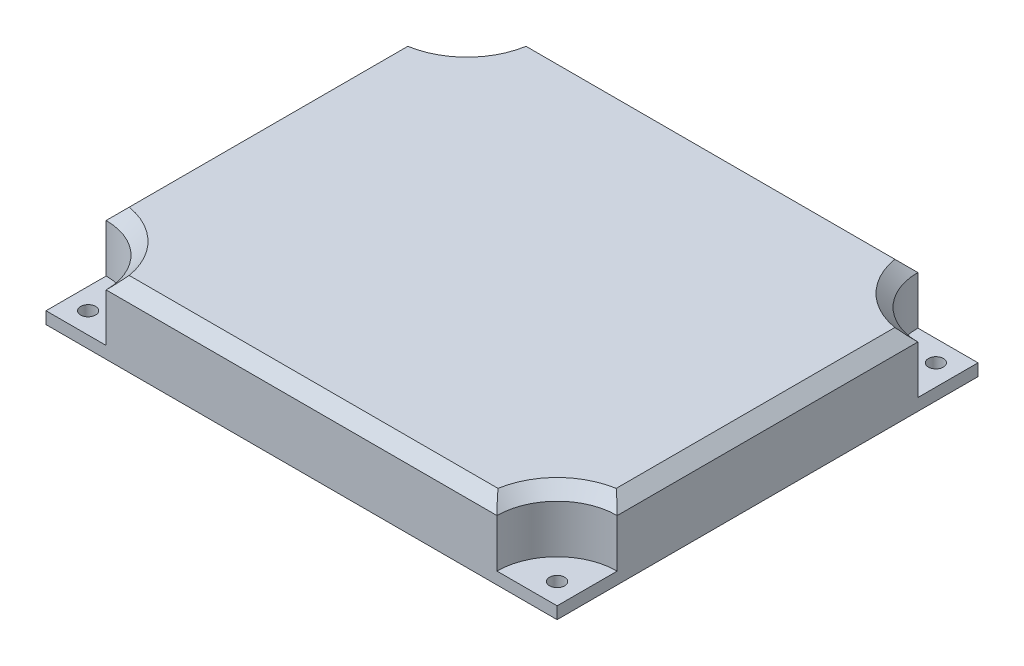
from build123d import *

# Parameters (mm, degrees)
SKETCH2_W                 = 85
SKETCH2_H                 = 70
BOSS_EXTRUDE1_DEPTH       = 12
SKETCH4_R                 = 10
CUT_EXTRUDE3_DEPTH        = 10
FILLET2_SIZE              = 2
M3X0_5_TAPPED_HOLE1_D     = 2.5
M3X0_5_TAPPED_HOLE1_DEPTH = 10
M3X0_5_TAPPED_HOLE1_TIP   = 0.751075774
CUT_EXTRUDE4_DEPTH        = 8


with BuildPart() as part:
    # Sketch2 → Boss-Extrude1 (new body)
    with BuildSketch(Plane(origin=(0, 0, 0), x_dir=(1, 0, 0), z_dir=(0, 1, 0))):
        Rectangle(SKETCH2_W, SKETCH2_H)
    extrude(amount=BOSS_EXTRUDE1_DEPTH)

    # Sketch4 → Cut-Extrude3 (cut)
    with BuildSketch(Plane(origin=(0, 12, 0), x_dir=(1, 0, 0), z_dir=(0, 1, 0))):
        with Locations((42.5, -35)):
            Circle(SKETCH4_R)
        with Locations((-42.5, -35)):
            Circle(SKETCH4_R)
        with Locations((-42.5, 35)):
            Circle(SKETCH4_R)
        with Locations((42.5, 35)):
            Circle(SKETCH4_R)
    extrude(amount=-CUT_EXTRUDE3_DEPTH, mode=Mode.SUBTRACT)

    # Fillet2
    fillet2_edges = [part.edges().sort_by_distance(p)[0] for p in [
        (42.5, 12, 0),
        (35.428932188, 12, 27.928932188),
        (0, 12, 35),
        (-35.428932188, 12, 27.928932188),
        (-42.5, 12, 0),
        (-35.428932188, 12, -27.928932188),
        (0, 12, -35),
        (35.428932188, 12, -27.928932188),
    ]]
    chamfer(fillet2_edges, length=FILLET2_SIZE)

    # M3x0.5 Tapped Hole1
    with Locations(Plane(origin=(0, 2, 0), x_dir=(1, 0, 0), z_dir=(0, 1, 0))):
        with Locations((-39, 31.5), (-39, -31.5), (39, -31.5), (39, 31.5)):
            Hole(M3X0_5_TAPPED_HOLE1_D / 2, depth=M3X0_5_TAPPED_HOLE1_DEPTH)
            with Locations((0, 0, -(M3X0_5_TAPPED_HOLE1_DEPTH + M3X0_5_TAPPED_HOLE1_TIP / 2))):  # 118° drill point
                Cone(0, M3X0_5_TAPPED_HOLE1_D / 2, M3X0_5_TAPPED_HOLE1_TIP, mode=Mode.SUBTRACT)

    # Sketch8 → Cut-Extrude4 (cut)
    with BuildSketch(Plane.XZ):
        with BuildLine():
            Line((35.95, -26.45), (35.95, 26.45))
            ThreePointArc((35.95, 26.45), (35.657106781, 27.157106781), (34.95, 27.45))
            Line((34.95, 27.45), (-34.95, 27.45))
            ThreePointArc((-34.95, 27.45), (-35.657106781, 27.157106781), (-35.95, 26.45))
            Line((-35.95, 26.45), (-35.95, -26.45))
            ThreePointArc((-35.95, -26.45), (-35.657106781, -27.157106781), (-34.95, -27.45))
            Line((-34.95, -27.45), (34.95, -27.45))
            ThreePointArc((34.95, -27.45), (35.657106781, -27.157106781), (35.95, -26.45))
        make_face()
    extrude(amount=-CUT_EXTRUDE4_DEPTH, mode=Mode.SUBTRACT)


solid = part.part
